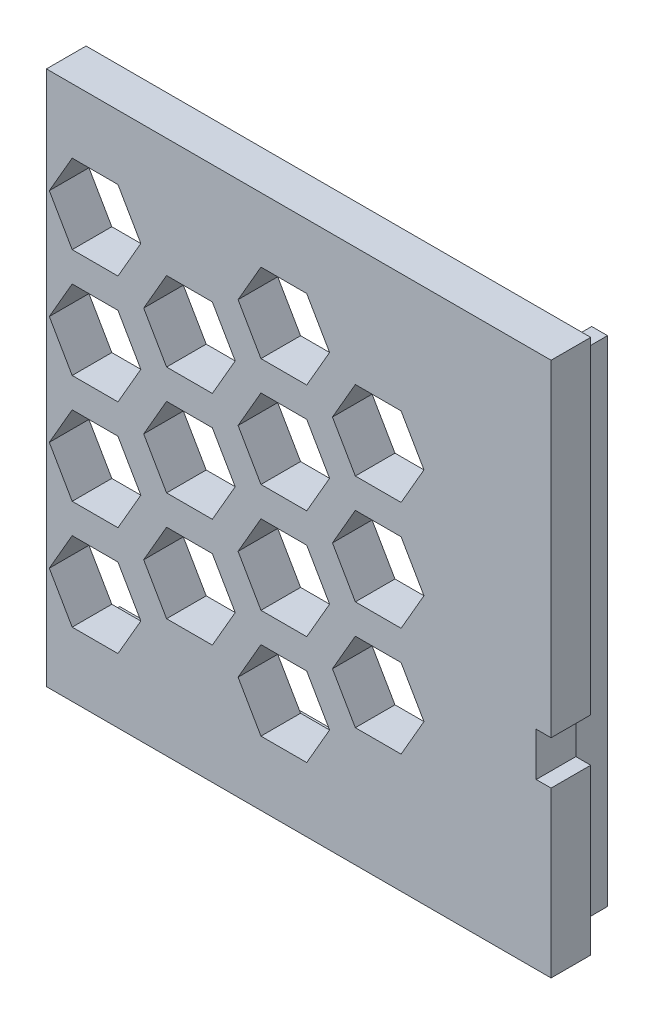
from build123d import *

# Parameters (mm, degrees)
SKETCH1_W           = 36.5
SKETCH1_H           = 27
BOSS_EXTRUDE1_DEPTH = 2
BOSS_EXTRUDE2_DEPTH = 1.7
CUT_EXTRUDE1_REACH  = 24.788
FILL_PATTERN1_DEPTH = 2
CUT_EXTRUDE3_REACH  = 25
SKETCH5_W           = 0.75
SKETCH5_H           = 2.2
SKETCH6_W           = 11.033121635
SKETCH6_H           = 27
CUT_EXTRUDE4_DEPTH  = 24.000054348


# Read off the part's stored shape, not the designer's step: Fill Pattern1
with BuildPart() as part:
    # Sketch1 → Boss-Extrude1 (new body)
    with BuildSketch(Plane.XY):
        Rectangle(SKETCH1_W, SKETCH1_H)
    extrude(amount=BOSS_EXTRUDE1_DEPTH)

    # Sketch2 → Boss-Extrude2 (add)
    with BuildSketch(Plane(origin=(0, 0, 0), x_dir=(-1, 0, 0), z_dir=(0, 0, -1))):
        Polygon((-17.4, 12.3), (-16.6, 12.3), (-16.6, -11.85), (0, -11.85), (0, -12.65), (-17.4, -12.65), align=None)
    boss_extrude2 = extrude(amount=BOSS_EXTRUDE2_DEPTH)

    # Mirror1: Boss-Extrude2 across plane
    add(boss_extrude2.mirror(Plane(origin=(0, 0, 0), x_dir=(0, 0, 1), z_dir=(1, 0, 0))))

    # Sketch3 → Cut-Extrude1 (cut, up to next)
    with BuildSketch(Plane(origin=(0, 0, 0), x_dir=(-1, 0, 0), z_dir=(0, 0, -1)), mode=Mode.PRIVATE) as cut_extrude1_sk1:
        Polygon((-1.154700538, 2), (-2.309401077, 0), (-1.154700538, -2), (1.154700538, -2), (2.309401077, 0), (1.154700538, 2), align=None)
    cut_extrude1_tool1 = extrude(cut_extrude1_sk1.sketch, amount=-CUT_EXTRUDE1_REACH, mode=Mode.PRIVATE) & part.part
    add(cut_extrude1_tool1.solids().sort_by_distance((0, 0, 0))[0], mode=Mode.SUBTRACT)

    # Fill Pattern1 outline → Fill Pattern1 (cut)
    with BuildSketch(Plane.XY):
        Polygon((11.835680518, 0), (10.68097998, 2), (8.371578903, 2), (7.216878365, 0), (8.371578903, -2), (10.68097998, -2), align=None)
        Polygon((-7.216878365, 0), (-8.371578903, 2), (-10.68097998, 2), (-11.835680518, 0), (-10.68097998, -2), (-8.371578903, -2), align=None)
        Polygon((-3.608439182, -6.25), (-5.917840259, -6.25), (-7.072540798, -8.25), (-5.917840259, -10.25), (-3.608439182, -10.25), (-2.453738644, -8.25), align=None)
        Polygon((5.917840259, 10.25), (3.608439182, 10.25), (2.453738644, 8.25), (3.608439182, 6.25), (5.917840259, 6.25), (7.072540798, 8.25), align=None)
        Polygon((-5.917840259, 10.25), (-7.072540798, 8.25), (-5.917840259, 6.25), (-3.608439182, 6.25), (-2.453738644, 8.25), (-3.608439182, 10.25), align=None)
        Polygon((3.608439182, -6.25), (2.453738644, -8.25), (3.608439182, -10.25), (5.917840259, -10.25), (7.072540798, -8.25), (5.917840259, -6.25), align=None)
        Polygon((2.309401077, 5.5), (1.154700538, 7.5), (-1.154700538, 7.5), (-2.309401077, 5.5), (-1.154700538, 3.5), (1.154700538, 3.5), align=None)
        Polygon((-7.216878365, 5.5), (-8.371578903, 7.5), (-10.68097998, 7.5), (-11.835680518, 5.5), (-10.68097998, 3.5), (-8.371578903, 3.5), align=None)
        Polygon((11.835680518, 5.5), (10.68097998, 7.5), (8.371578903, 7.5), (7.216878365, 5.5), (8.371578903, 3.5), (10.68097998, 3.5), align=None)
        Polygon((-3.608439182, -0.75), (-5.917840259, -0.75), (-7.072540798, -2.75), (-5.917840259, -4.75), (-3.608439182, -4.75), (-2.453738644, -2.75), align=None)
        Polygon((3.608439182, -0.75), (2.453738644, -2.75), (3.608439182, -4.75), (5.917840259, -4.75), (7.072540798, -2.75), (5.917840259, -0.75), align=None)
        Polygon((7.072540798, 2.75), (5.917840259, 4.75), (3.608439182, 4.75), (2.453738644, 2.75), (3.608439182, 0.75), (5.917840259, 0.75), align=None)
        Polygon((-2.453738644, 2.75), (-3.608439182, 4.75), (-5.917840259, 4.75), (-7.072540798, 2.75), (-5.917840259, 0.75), (-3.608439182, 0.75), align=None)
        Polygon((1.154700538, -3.5), (-1.154700538, -3.5), (-2.309401077, -5.5), (-1.154700538, -7.5), (1.154700538, -7.5), (2.309401077, -5.5), align=None)
        Polygon((8.371578903, -3.5), (7.216878365, -5.5), (8.371578903, -7.5), (10.68097998, -7.5), (11.835680518, -5.5), (10.68097998, -3.5), align=None)
        Polygon((-7.216878365, -5.5), (-8.371578903, -3.5), (-10.68097998, -3.5), (-11.835680518, -5.5), (-10.68097998, -7.5), (-8.371578903, -7.5), align=None)
    extrude(amount=FILL_PATTERN1_DEPTH, mode=Mode.SUBTRACT)

    # Sketch5 → Cut-Extrude3 (cut, up to next)
    with BuildSketch(Plane.XY.offset(2), mode=Mode.PRIVATE) as cut_extrude3_sk1:
        with Locations((17.875, -4.1)):
            Rectangle(SKETCH5_W, SKETCH5_H)
    cut_extrude3_tool1 = extrude(cut_extrude3_sk1.sketch, amount=-CUT_EXTRUDE3_REACH, mode=Mode.PRIVATE) & part.part
    cut_extrude3 = cut_extrude3_tool1.solids().sort_by_distance((17.875, -4.1, 2))[0]
    add(cut_extrude3, mode=Mode.SUBTRACT)

    # Mirror2: Cut-Extrude3 across plane
    add(cut_extrude3.mirror(Plane(origin=(0, 0, 0), x_dir=(0, 0, 1), z_dir=(1, 0, 0))), mode=Mode.SUBTRACT)

    # Sketch6 → Cut-Extrude4 (cut, through all)
    with BuildSketch(Plane.XY.offset(2)):
        with Locations((-12.733439182, 0)):
            Rectangle(SKETCH6_W, SKETCH6_H)
    extrude(amount=-CUT_EXTRUDE4_DEPTH, mode=Mode.SUBTRACT)


solid = part.part
